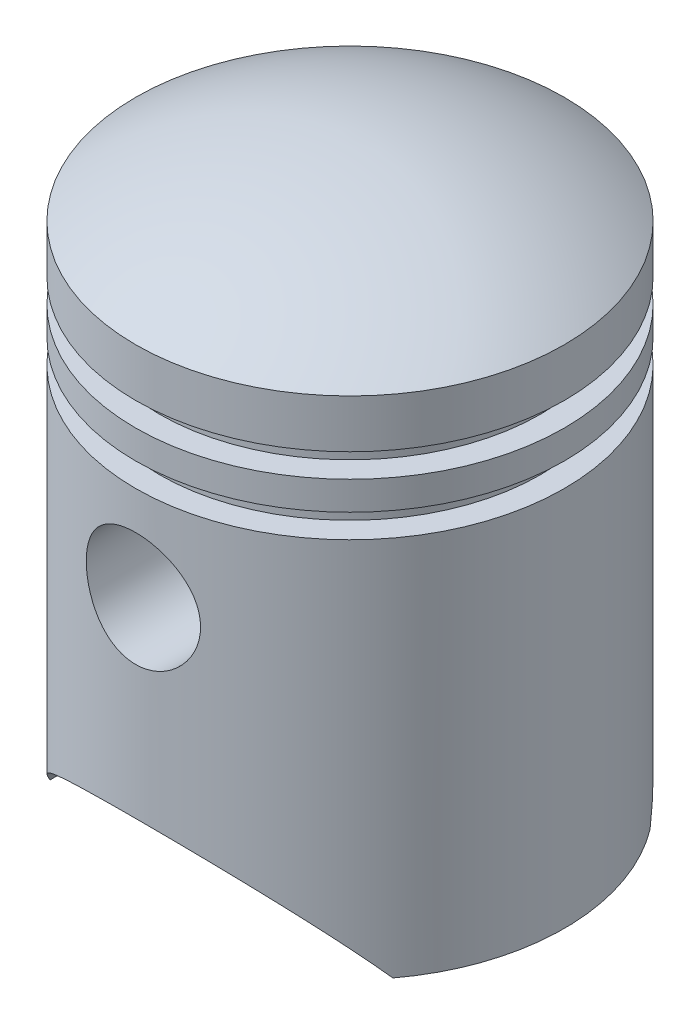
from build123d import *

# Parameters (mm, degrees)
SZKIC2_W                         = 2.5
SZKIC2_H                         = 2.5
SZYK_LINIOWY1_COUNT              = 2
SZYK_LINIOWY1_PITCH              = 5.5
WYTNIJ_WYCI_GNI_CIE1_DEPTH       = 68.915388536
WYTNIJ_WYCI_GNI_CIE1_DEPTH_BACK  = 68.915388536
WYTNIJ_WYCI_GNI_CIE3_DEPTH       = 68.915388602
WYTNIJ_WYCI_GNI_CIE3_DEPTH_BACK  = 68.915388602
SZKIC5_R                         = 6
DODANIE_WYCI_GNI_CIE1_REACH      = 79.915
DODANIE_WYCI_GNI_CIE1_END_RADIUS = 20.5
DODANIE_WYCI_GNI_CIE1_START      = 10
SZKIC6_R                         = 7.5
SZKIC6_R_2                       = 6


# Read off the part's stored shape, not the designer's step: Skorupa1
with BuildPart() as part:
    # Szkic1 → Obrót1 (revolve)
    with BuildSketch(Plane.XY):
        with BuildLine():
            Line((0, 0), (0, 60))
            ThreePointArc((0, 60), (11.771243445, 58.228756555), (22.5, 53.071891388))
            Line((22.5, 53.071891388), (22.5, 0))
            Line((22.5, 0), (0, 0))
        make_face()
    revolve(axis=Axis((0, 0, 0), (0, 1, 0)))

    # Szkic2 → Wycięcie-obrót1 (revolve, cut)
    with BuildSketch(Plane.XY, mode=Mode.PRIVATE) as wyci_cie_obr_t1_sk:
        with Locations((21.25, 41.25)):
            Rectangle(SZKIC2_W, SZKIC2_H)
    wyci_cie_obr_t1 = revolve(wyci_cie_obr_t1_sk.sketch.rotate(Axis((0, 69.339068265, 0), (0, 1, 0)), 90), axis=Axis((0, 69.339068265, 0), (0, 1, 0)), mode=Mode.SUBTRACT)

    # Szyk liniowy1: Wycięcie-obrót1 ×2
    with Locations(*[(0, i * SZYK_LINIOWY1_PITCH, 0) for i in range(1, SZYK_LINIOWY1_COUNT)]):
        add(wyci_cie_obr_t1, mode=Mode.SUBTRACT)

    # Skorupa1 outline → Skorupa1 (revolve, cut)
    with BuildSketch(Plane.XY):
        with BuildLine():
            Line((20.5, 0), (20.5, 38))
            Line((20.5, 38), (18, 38))
            Line((18, 38), (18, 50))
            Line((18, 50), (20.5, 50))
            Line((20.5, 50), (20.500000011, 51.996093505))
            ThreePointArc((20.500000011, 51.996093505), (10.680553516, 56.468147425), (0, 58))
            Line((0, 58), (0, 0))
            Line((0, 0), (20.5, 0))
        make_face()
    revolve(axis=Axis((0, 0, 0), (0, 1, 0)), mode=Mode.SUBTRACT)

    # Szkic3 → Wytnij-wyciągnięcie1 (cut, two sides: drawn at the far end of the back side and taken through both)
    with BuildSketch(Plane.XY.offset(-WYTNIJ_WYCI_GNI_CIE1_DEPTH_BACK)):
        with BuildLine():
            Line((-99.770112831, -131.416252764), (-18, 0))
            ThreePointArc((-18, 0), (0, 10), (18, 0))
            Line((18, 0), (99.770112831, -131.416252764))
            Line((99.770112831, -131.416252764), (99.770112831, -440.974537052))
            Line((99.770112831, -440.974537052), (-99.770112831, -440.974537052))
            Line((-99.770112831, -440.974537052), (-99.770112831, -131.416252764))
        make_face()
    extrude(amount=WYTNIJ_WYCI_GNI_CIE1_DEPTH + WYTNIJ_WYCI_GNI_CIE1_DEPTH_BACK, mode=Mode.SUBTRACT)

    # Szkic5 → Wytnij-wyciągnięcie3 (cut, two sides: drawn at the far end of the back side and taken through both)
    with BuildSketch(Plane.XY.offset(-WYTNIJ_WYCI_GNI_CIE3_DEPTH_BACK)):
        with Locations((0, 30)):
            Circle(SZKIC5_R)
    extrude(amount=WYTNIJ_WYCI_GNI_CIE3_DEPTH + WYTNIJ_WYCI_GNI_CIE3_DEPTH_BACK, mode=Mode.SUBTRACT)

    # Dodanie-wyciągnięcie1: up to this cylinder (the profile starts inside it)
    dodanie_wyci_gni_cie1_end = Plane(origin=(0, 30, 0), z_dir=(0, -1, 0)) * Cylinder(DODANIE_WYCI_GNI_CIE1_END_RADIUS, 201.83, mode=Mode.PRIVATE)
    # Szkic6 → Dodanie-wyciągnięcie1 (add, up to the surface)
    with BuildSketch(Plane.XY.offset(DODANIE_WYCI_GNI_CIE1_START), mode=Mode.PRIVATE) as dodanie_wyci_gni_cie1_sk1:
        with Locations(Location((0, 30, 0), (0, 0, 180))):
            Circle(SZKIC6_R)
        with Locations((0, 30)):
            Circle(SZKIC6_R_2, mode=Mode.SUBTRACT)
    dodanie_wyci_gni_cie1_tool1 = extrude(dodanie_wyci_gni_cie1_sk1.sketch, amount=DODANIE_WYCI_GNI_CIE1_REACH, mode=Mode.PRIVATE) & dodanie_wyci_gni_cie1_end
    dodanie_wyci_gni_cie1 = dodanie_wyci_gni_cie1_tool1.solids().sort_by_distance((7.287868, 30, 10))[0]
    add(dodanie_wyci_gni_cie1)

    # Lustro1: Dodanie-wyciągnięcie1 across plane
    add(dodanie_wyci_gni_cie1.mirror(Plane.XY))


solid = part.part
